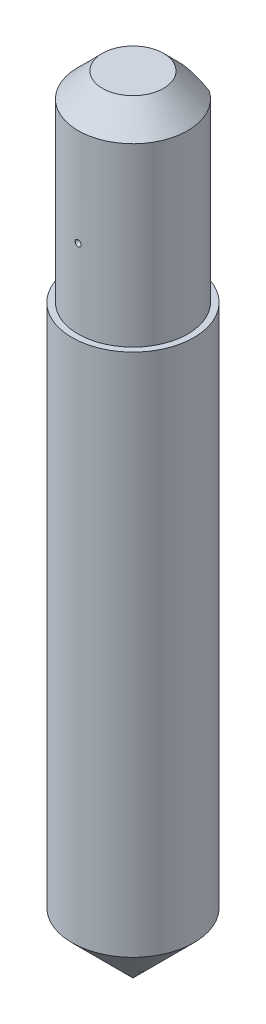
from build123d import *

# Parameters (mm, degrees)
SKETCH1_R           = 5
BOSS_EXTRUDE1_DEPTH = 48
CHAMFER1_SIZE       = 5
BOSS_EXTRUDE2_DEPTH = 16.45


with BuildPart() as part:
    # Sketch1 → Boss-Extrude1 (new body)
    with BuildSketch(Plane(origin=(0, 0, 0), x_dir=(1, 0, 0), z_dir=(0, 1, 0))):
        with Locations(Location((0, 0, 0), (0, 0, 270))):
            Circle(SKETCH1_R)
    extrude(amount=BOSS_EXTRUDE1_DEPTH)

    # Chamfer1
    chamfer1_edges = [part.edges().sort_by_distance(p)[0] for p in [
        (0, 0, -5),
    ]]
    chamfer(chamfer1_edges, length=CHAMFER1_SIZE)

    # Sketch2 → Boss-Extrude2 (add)
    with BuildSketch(Plane(origin=(0, 48, 0), x_dir=(1, 0, 0), z_dir=(0, 1, 0))):
        with BuildLine():
            Line((-2.561249695, 3.7), (2.561249695, 3.7))
            ThreePointArc((2.561249695, 3.7), (0, -4.5), (-2.561249695, 3.7))
        make_face()
    extrude(amount=BOSS_EXTRUDE2_DEPTH)

    # Chamfer2: read off the stored shape, not the designer's step
    # Chamfer2 outline → Chamfer2 (revolve, cut)
    with BuildSketch(Plane.XY):
        Polygon((4.5, 64.45), (2.5, 64.45), (4.5, 62.45), align=None)
    revolve(axis=Axis((0, 0, 0), (0, 1, 0)), mode=Mode.SUBTRACT)

    # Sketch3 → Cut-Revolve1 (revolve, cut)
    with BuildSketch(Plane(origin=(0, 0, 0), x_dir=(0, 0, -1), z_dir=(1, 0, 0))):
        with BuildLine():
            Line((-4.5, 54.2), (-4.5, 54.7))
            ThreePointArc((-4.5, 54.7), (-4.25, 54.45), (-4.5, 54.2))
        make_face()
    revolve(axis=Axis((0, 54.2, 4.5), (0, 1, 0)), mode=Mode.SUBTRACT)


solid = part.part
